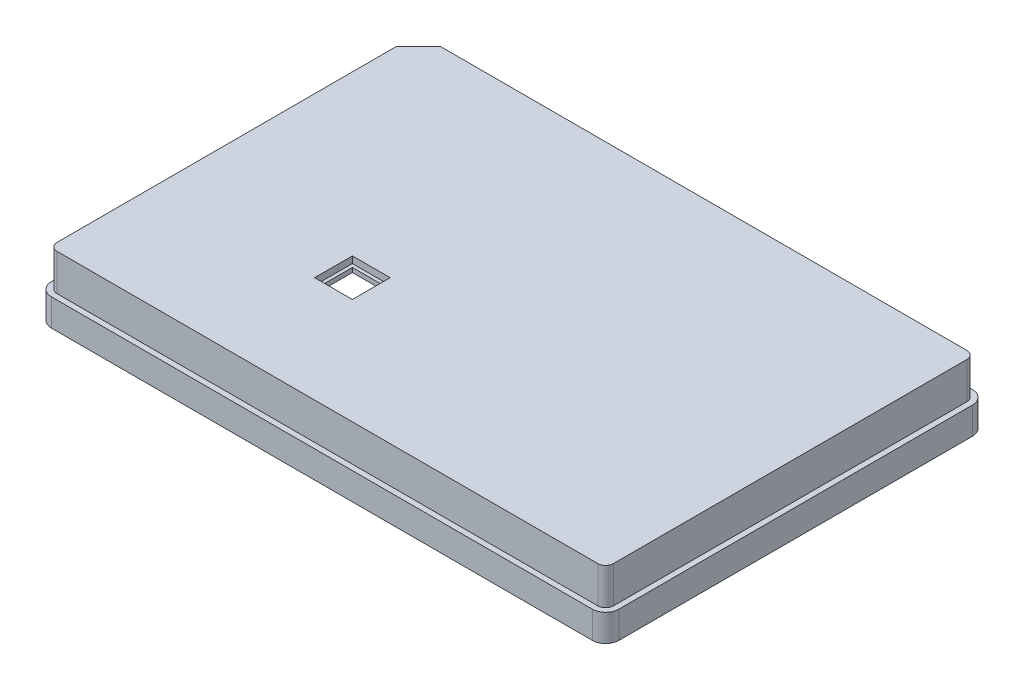
from build123d import *

# Parameters (mm, degrees)
SKETCH1_W           = 127.75
SKETCH1_H           = 85.6
BOSS_EXTRUDE1_DEPTH = 14.35
FILLET1_R           = 3
CUT_FLANGE_DEPTH    = 8.25
SKETCH5_W           = 80.1
SKETCH5_H           = 0.75
CUT_PAPERSLOT_DEPTH = 123.75
SHELL1_DEPTH        = 11.1
SHELL1_2_DEPTH      = 5.1
SKETCH4_W           = 8.5
SKETCH4_H           = 8.5
CUT_EXTRUDE3_DEPTH  = 20


# Read off the part's stored shape, not the designer's step: Shell1
with BuildPart() as part:
    # Sketch1 → Boss-Extrude1 (new body)
    with BuildSketch(Plane(origin=(0, 0, 0), x_dir=(1, 0, 0), z_dir=(0, 1, 0))):
        Rectangle(SKETCH1_W, SKETCH1_H)
    extrude(amount=BOSS_EXTRUDE1_DEPTH)

    # Fillet1
    fillet1_edges = [part.edges().sort_by_distance(p)[0] for p in [
        (-63.875, 7.175, -42.8),
        (63.875, 7.175, -42.8),
        (63.875, 7.175, 42.8),
        (-63.875, 7.175, 42.8),
    ]]
    fillet(fillet1_edges, radius=FILLET1_R)

    # Sketch3 → Cut-Flange (cut)
    with BuildSketch(Plane(origin=(0, 14.35, 0), x_dir=(1, 0, 0), z_dir=(0, 1, 0))):
        with BuildLine():
            Line((-63.875, 39.8), (-63.875, -39.8))
            ThreePointArc((-63.875, -39.8), (-62.996320344, -41.921320344), (-60.875, -42.8))
            Line((-60.875, -42.8), (60.875, -42.8))
            ThreePointArc((60.875, -42.8), (62.996320344, -41.921320344), (63.875, -39.8))
            Line((63.875, -39.8), (63.875, 39.8))
            ThreePointArc((63.875, 39.8), (62.996320344, 41.921320344), (60.875, 42.8))
            Line((60.875, 42.8), (-60.875, 42.8))
            ThreePointArc((-60.875, 42.8), (-62.996320344, 41.921320344), (-63.875, 39.8))
        make_face()
        with BuildLine():
            Line((-62.625, 36.600252532), (-62.625, -39.8))
            ThreePointArc((-62.625, -39.8), (-62.112436867, -41.037436867), (-60.875, -41.55))
            Line((-60.875, -41.55), (60.875, -41.55))
            ThreePointArc((60.875, -41.55), (62.112436867, -41.037436867), (62.625, -39.8))
            Line((62.625, -39.8), (62.625, 39.8))
            ThreePointArc((62.625, 39.8), (62.112436867, 41.037436867), (60.875, 41.55))
            Line((60.875, 41.55), (-57.675252532, 41.55))
            Line((-57.675252532, 41.55), (-62.625, 36.600252532))
        make_face(mode=Mode.SUBTRACT)
    extrude(amount=-CUT_FLANGE_DEPTH, mode=Mode.SUBTRACT)

    # Sketch5 → Cut-PaperSlot (cut)
    with BuildSketch(Plane.ZY.offset(62.625)):
        with Locations((0, 12.475)):
            Rectangle(SKETCH5_W, SKETCH5_H)
    extrude(amount=-CUT_PAPERSLOT_DEPTH, mode=Mode.SUBTRACT)

    # Shell1 outline → Shell1 (cut)
    with BuildSketch(Plane(origin=(0, 0, 0), x_dir=(1, 0, 0), z_dir=(0, 1, 0))):
        with BuildLine():
            Line((-61.625, 36.186038969), (-61.625, -39.8))
            ThreePointArc((-61.625, -39.8), (-61.405330086, -40.330330086), (-60.875, -40.55))
            Line((-60.875, -40.55), (60.875, -40.55))
            ThreePointArc((60.875, -40.55), (61.405330086, -40.330330086), (61.625, -39.8))
            Line((61.625, -39.8), (61.625, 39.8))
            ThreePointArc((61.625, 39.8), (61.405330086, 40.330330086), (60.875, 40.55))
            Line((60.875, 40.55), (-57.261038969, 40.55))
            Line((-57.261038969, 40.55), (-61.625, 36.186038969))
        make_face()
    extrude(amount=SHELL1_DEPTH, mode=Mode.SUBTRACT)

    # Shell1 2 outline → Shell1 2 (cut)
    with BuildSketch(Plane(origin=(0, 0, 0), x_dir=(1, 0, 0), z_dir=(0, 1, 0))):
        with BuildLine():
            Line((-62.875, 39.8), (-62.875, -39.8))
            ThreePointArc((-62.875, -39.8), (-62.289213562, -41.214213562), (-60.875, -41.8))
            Line((-60.875, -41.8), (60.875, -41.8))
            ThreePointArc((60.875, -41.8), (62.289213562, -41.214213562), (62.875, -39.8))
            Line((62.875, -39.8), (62.875, 39.8))
            ThreePointArc((62.875, 39.8), (62.289213562, 41.214213562), (60.875, 41.8))
            Line((60.875, 41.8), (-60.875, 41.8))
            ThreePointArc((-60.875, 41.8), (-62.289213562, 41.214213562), (-62.875, 39.8))
        make_face()
        with BuildLine():
            ThreePointArc((-60.875, -40.55), (-61.405330086, -40.330330086), (-61.625, -39.8))
            Line((-61.625, -39.8), (-61.625, 36.186038969))
            Line((-61.625, 36.186038969), (-57.261038969, 40.55))
            Line((-57.261038969, 40.55), (60.875, 40.55))
            ThreePointArc((60.875, 40.55), (61.405330086, 40.330330086), (61.625, 39.8))
            Line((61.625, 39.8), (61.625, -39.8))
            ThreePointArc((61.625, -39.8), (61.405330086, -40.330330086), (60.875, -40.55))
            Line((60.875, -40.55), (-60.875, -40.55))
        make_face(mode=Mode.SUBTRACT)
    extrude(amount=SHELL1_2_DEPTH, mode=Mode.SUBTRACT)

    # Sketch4 → Cut-Extrude3 (cut)
    with BuildSketch(Plane(origin=(0, 14.35, 0), x_dir=(1, 0, 0), z_dir=(0, 1, 0))):
        with Locations((-22.495, -13.44)):
            Rectangle(SKETCH4_W, SKETCH4_H)
    extrude(amount=-CUT_EXTRUDE3_DEPTH, mode=Mode.SUBTRACT)


solid = part.part
